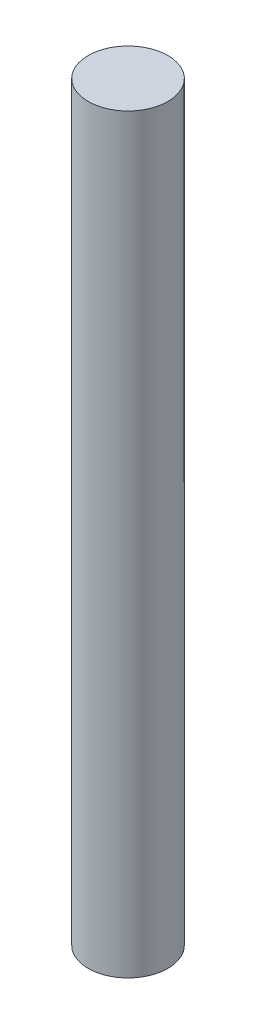
from build123d import *

# Parameters (mm, degrees)
SKETCH1_R           = 1.5
BOSS_EXTRUDE1_DEPTH = 28.27


with BuildPart() as part:
    # Sketch1 → Boss-Extrude1 (new body)
    with BuildSketch(Plane(origin=(0, 0, 0), x_dir=(1, 0, 0), z_dir=(0, 1, 0))):
        Circle(SKETCH1_R)
    extrude(amount=BOSS_EXTRUDE1_DEPTH)


solid = part.part
